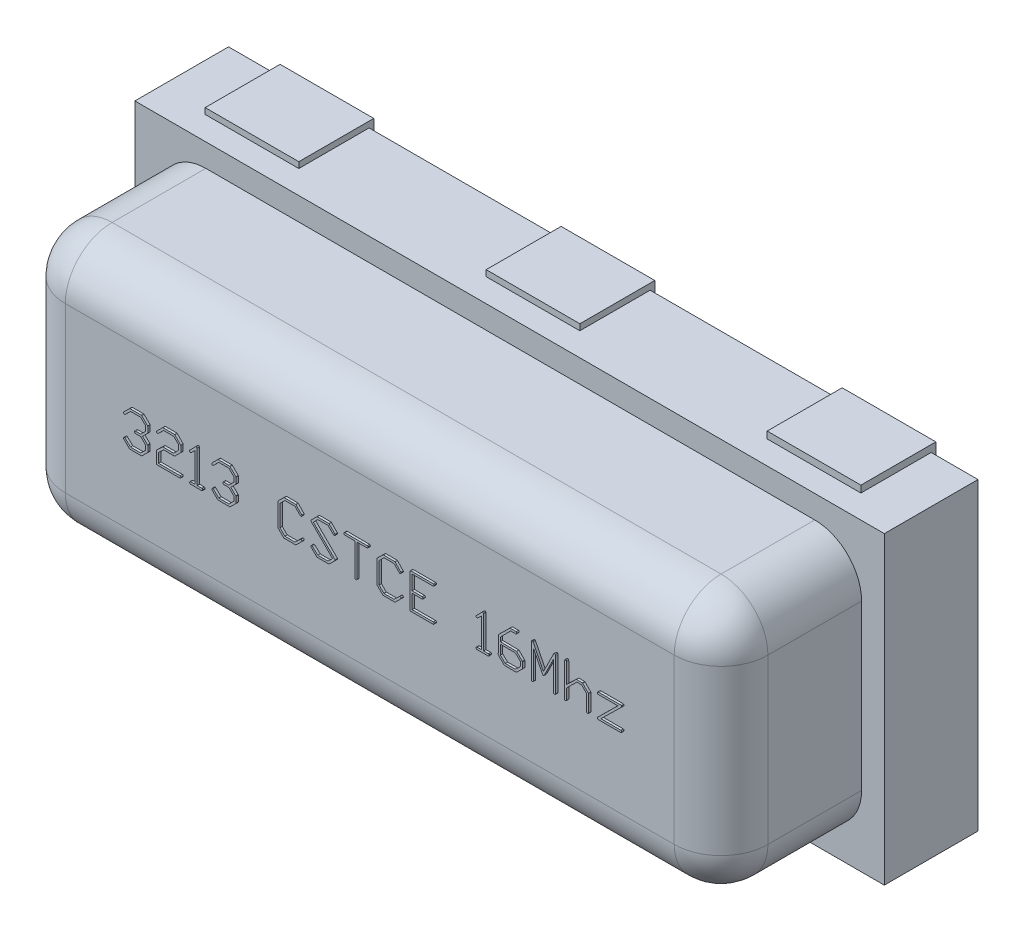
from build123d import *

# Parameters (mm, degrees)
SKETCH2_W                  = 3.2
SKETCH2_H                  = 1.3
BOSS_EXTRUDE1_DEPTH        = 0.4
SKETCH3_W                  = 3
SKETCH3_H                  = 1.1
BOSS_EXTRUDE2_DEPTH        = 0.6
FILLET1_R                  = 0.2
FILLET2_R                  = 0.2
BOSS_EXTRUDE4_DEPTH        = 0.3
BOSS_EXTRUDE4_DEPTH_BACK   = 0.02
SKETCH5_W                  = 0.4
SKETCH5_H                  = 1.35
BOSS_EXTRUDE4_2_DEPTH      = 0.3
BOSS_EXTRUDE4_2_DEPTH_BACK = 0.02
BOSS_EXTRUDE4_3_DEPTH      = 0.3
BOSS_EXTRUDE4_3_DEPTH_BACK = 0.02
BOSS_EXTRUDE5_DEPTH        = 0.01


# Read off the part's stored shape, not the designer's step: Boss-Extrude5
with BuildPart() as part:
    # Sketch2 → Boss-Extrude1 (new body)
    with BuildSketch(Plane.XY):
        with Locations((1.6, 0.65)):
            Rectangle(SKETCH2_W, SKETCH2_H)
    extrude(amount=BOSS_EXTRUDE1_DEPTH)


with BuildPart() as body_2:
    # Sketch3 → Boss-Extrude2 (new body)
    with BuildSketch(Plane.XY.offset(0.4)):
        with Locations((1.602928939, 0.652066437)):
            Rectangle(SKETCH3_W, SKETCH3_H)
    extrude(amount=BOSS_EXTRUDE2_DEPTH)

    # Fillet1
    fillet1_edges = [body_2.edges().sort_by_distance(p)[0] for p in [
        (3.102928939, 0.652066437, 1),
        (1.602928939, 1.202066437, 1),
        (0.102928939, 0.652066437, 1),
        (1.602928939, 0.102066437, 1),
    ]]
    fillet(fillet1_edges, radius=FILLET1_R)

    # Fillet2
    # the kernel refuses this fillet: 0.2 mm, written as the material it takes off along each edge
    with BuildSketch(Plane(origin=(2.902928939, 0.302066437, 0.8), x_dir=(0, -1, 0), z_dir=(1, 0, 0))) as fillet2_piece_1_section:
        Polygon((0, 0), (FILLET2_R, 0), (FILLET2_R, -FILLET2_R), (0, -FILLET2_R), align=None)
    fillet2_piece_1 = extrude(amount=FILLET2_R, mode=Mode.PRIVATE)
    fillet2_piece_1 = fillet2_piece_1 - Plane(origin=(2.902928939, 0.302066437, 0.8), x_dir=(0, 0.7071067811865475, -0.7071067811865475), z_dir=(1, 0, 0)) * Sphere(FILLET2_R, mode=Mode.PRIVATE)
    add(fillet2_piece_1, mode=Mode.SUBTRACT)
    with BuildSketch(Plane(origin=(0.302928939, 0.302066437, 0.8), x_dir=(0, -1, 0), z_dir=(-1, 0, 0))) as fillet2_piece_2_section:
        Polygon((0, 0), (FILLET2_R, 0), (FILLET2_R, FILLET2_R), (0, FILLET2_R), align=None)
    fillet2_piece_2 = extrude(amount=FILLET2_R, mode=Mode.PRIVATE)
    fillet2_piece_2 = fillet2_piece_2 - Plane(origin=(0.302928939, 0.302066437, 0.8), x_dir=(0, 0.7071067811865475, -0.7071067811865475), z_dir=(-1, 0, 0)) * Sphere(FILLET2_R, mode=Mode.PRIVATE)
    add(fillet2_piece_2, mode=Mode.SUBTRACT)
    with BuildSketch(Plane(origin=(2.902928939, 1.002066437, 0.8), x_dir=(1, 0, 0), z_dir=(0, 1, 0))) as fillet2_piece_3_section:
        Polygon((0, 0), (FILLET2_R, 0), (FILLET2_R, -FILLET2_R), (0, -FILLET2_R), align=None)
    fillet2_piece_3 = extrude(amount=FILLET2_R, mode=Mode.PRIVATE)
    fillet2_piece_3 = fillet2_piece_3 - Plane(origin=(2.902928939, 1.002066437, 0.8), x_dir=(-0.7071067811865475, 0, -0.7071067811865475), z_dir=(0, 1, 0)) * Sphere(FILLET2_R, mode=Mode.PRIVATE)
    add(fillet2_piece_3, mode=Mode.SUBTRACT)
    with BuildSketch(Plane(origin=(0.302928939, 1.002066437, 0.8), x_dir=(-1, 0, 0), z_dir=(0, 1, 0))) as fillet2_piece_4_section:
        Polygon((0, 0), (FILLET2_R, 0), (FILLET2_R, FILLET2_R), (0, FILLET2_R), align=None)
    fillet2_piece_4 = extrude(amount=FILLET2_R, mode=Mode.PRIVATE)
    fillet2_piece_4 = fillet2_piece_4 - Plane(origin=(0.302928939, 1.002066437, 0.8), x_dir=(0.7071067811865475, 0, -0.7071067811865475), z_dir=(0, 1, 0)) * Sphere(FILLET2_R, mode=Mode.PRIVATE)
    add(fillet2_piece_4, mode=Mode.SUBTRACT)
    with BuildSketch(Plane(origin=(0.102928939, 1.202066437, -0.1), x_dir=(1, 0, 0), z_dir=(0, 0, 1)), Plane(origin=(0.102928939, 0.102066437, -0.1), x_dir=(0, 1, 0), z_dir=(0, 0, 1))) as fillet2_piece_5:
        with BuildLine():
            CenterArc((FILLET2_R, -FILLET2_R), FILLET2_R, 90, 90)
            Line((0, -FILLET2_R), (0, 0))
            Line((0, 0), (FILLET2_R, 0))
        make_face()
    extrude(amount=0.9, mode=Mode.SUBTRACT)
    with BuildSketch(Plane(origin=(3.102928939, 1.202066437, -0.1), x_dir=(-1, 0, 0), z_dir=(0, 0, 1)), Plane(origin=(3.102928939, 0.102066437, -0.1), x_dir=(0, 1, 0), z_dir=(0, 0, 1))) as fillet2_piece_6:
        with BuildLine():
            CenterArc((FILLET2_R, FILLET2_R), FILLET2_R, 180, 90)
            Line((0, FILLET2_R), (0, 0))
            Line((0, 0), (FILLET2_R, 0))
        make_face()
    extrude(amount=0.9, mode=Mode.SUBTRACT)


with BuildPart() as body_3:
    # Sketch5 → Boss-Extrude4 (new, two sides: drawn at the far end of the back side and taken through both)
    with BuildSketch(Plane.XY.offset(-BOSS_EXTRUDE4_DEPTH_BACK)):
        with Locations((0.4, 0.650355211)):
            Rectangle(SKETCH5_W, SKETCH5_H)
    extrude(amount=BOSS_EXTRUDE4_DEPTH + BOSS_EXTRUDE4_DEPTH_BACK)


with BuildPart() as body_4:
    # Sketch5 → Boss-Extrude4 2 (new, two sides: drawn at the far end of the back side and taken through both)
    with BuildSketch(Plane.XY.offset(-BOSS_EXTRUDE4_2_DEPTH_BACK)):
        with Locations((1.6, 0.65103859)):
            Rectangle(SKETCH5_W, SKETCH5_H)
    extrude(amount=BOSS_EXTRUDE4_2_DEPTH + BOSS_EXTRUDE4_2_DEPTH_BACK)


with BuildPart() as body_5:
    # Sketch5 → Boss-Extrude4 3 (new, two sides: drawn at the far end of the back side and taken through both)
    with BuildSketch(Plane.XY.offset(-BOSS_EXTRUDE4_3_DEPTH_BACK)):
        with Locations((2.8, 0.654278449)):
            Rectangle(SKETCH5_W, SKETCH5_H)
    extrude(amount=BOSS_EXTRUDE4_3_DEPTH + BOSS_EXTRUDE4_3_DEPTH_BACK)


with BuildPart() as body_6:
    # Boss-Extrude5 outline → Boss-Extrude5 (new body)
    # profile 1 of 14: a face of its own
    with BuildSketch(Plane.XY.offset(1)):
        with BuildLine():
            add(Edge.make_bspline(
                [(2.683168451, 0.713430924), (2.683935612, 0.713401431), (2.685374021, 0.713346131), (2.686666749, 0.71271908), (2.687270013, 0.71242646)],
                knots=[0, 0, 0, 0, 0.533340216, 1, 1, 1, 1], degree=3))
            Line((2.683168451, 0.713430924), (2.591706397, 0.713430924))
            add(Edge.make_bspline(
                [(2.584730951, 0.708129585), (2.584772838, 0.708887929), (2.584848696, 0.710261285), (2.585570063, 0.711911603), (2.586716018, 0.712751094), (2.588009807, 0.713174934), (2.589717866, 0.713391381), (2.590998908, 0.713416855), (2.591706397, 0.713430924)],
                knots=[0, 0, 0, 0, 0.221332897, 0.400832246, 0.499547483, 0.62651614, 0.793733864, 1, 1, 1, 1], degree=3))
            add(Edge.make_bspline(
                [(2.587576933, 0.704502353), (2.587199603, 0.704686145), (2.586464753, 0.70504408), (2.585629939, 0.705917345), (2.584986842, 0.706937079), (2.584818756, 0.707720392), (2.584730951, 0.708129585)],
                knots=[0, 0, 0, 0, 0.259332585, 0.505050121, 0.741444638, 1, 1, 1, 1], degree=3))
            Line((2.587576933, 0.704502353), (2.672621576, 0.704502353))
            Line((2.672621576, 0.704502353), (2.585735415, 0.61867646))
            add(Edge.make_bspline(
                [(2.584730951, 0.615663067), (2.584784937, 0.616156228), (2.584902523, 0.617230356), (2.585443056, 0.618168852), (2.585735415, 0.61867646)],
                knots=[0, 0, 0, 0, 0.459127183, 1, 1, 1, 1], degree=3))
            add(Edge.make_bspline(
                [(2.587604835, 0.61164521), (2.587230396, 0.611841223), (2.586493395, 0.612227031), (2.58558199, 0.613127853), (2.58499499, 0.614318376), (2.584821589, 0.615201469), (2.584730951, 0.615663067)],
                knots=[0, 0, 0, 0, 0.243908595, 0.480079756, 0.728234661, 1, 1, 1, 1], degree=3))
            Line((2.587604835, 0.61164521), (2.68378229, 0.61164521))
            add(Edge.make_bspline(
                [(2.68830238, 0.616862844), (2.688280011, 0.616105081), (2.68824022, 0.614757112), (2.687707496, 0.613195303), (2.686951287, 0.6123025), (2.686091599, 0.611926922), (2.68502495, 0.611679088), (2.684221518, 0.611657184), (2.68378229, 0.61164521)],
                knots=[0, 0, 0, 0, 0.279967249, 0.498028594, 0.595548592, 0.703348784, 0.837823744, 1, 1, 1, 1], degree=3))
            add(Edge.make_bspline(
                [(2.685623808, 0.620573781), (2.686030341, 0.620445669), (2.686805065, 0.620201528), (2.687699333, 0.619352521), (2.688236673, 0.61820016), (2.688279202, 0.617334567), (2.68830238, 0.616862844)],
                knots=[0, 0, 0, 0, 0.253478621, 0.483050086, 0.718277531, 1, 1, 1, 1], degree=3))
            Line((2.685623808, 0.620573781), (2.599574701, 0.620573781))
            Line((2.599574701, 0.620573781), (2.687270013, 0.706399674))
            Line((2.687270013, 0.706399674), (2.68830238, 0.708408603))
            add(Edge.make_bspline(
                [(2.687270013, 0.71242646), (2.687574051, 0.71184293), (2.688228469, 0.710586927), (2.688276606, 0.709168199), (2.68830238, 0.708408603)],
                knots=[0, 0, 0, 0, 0.464593162, 1, 1, 1, 1], degree=3))
        make_face()
    # profile 2 of 14: a face of its own
    with BuildSketch(Plane.XY.offset(1)):
        with BuildLine():
            add(Edge.make_bspline(
                [(2.447286755, 0.76164521), (2.447715051, 0.761625023), (2.448520638, 0.761587053), (2.449640172, 0.76141946), (2.450577908, 0.761053499), (2.451069603, 0.760679833), (2.451304612, 0.760501237)],
                knots=[0, 0, 0, 0, 0.301552047, 0.567191846, 0.793137002, 1, 1, 1, 1], degree=3))
            add(Edge.make_bspline(
                [(2.443659522, 0.758799228), (2.443812181, 0.759177181), (2.444111669, 0.759918653), (2.444971525, 0.760761269), (2.446028678, 0.761398563), (2.44684942, 0.76155947), (2.447286755, 0.76164521)],
                knots=[0, 0, 0, 0, 0.248858434, 0.488213124, 0.727292693, 1, 1, 1, 1], degree=3))
            Line((2.443659522, 0.758799228), (2.443659522, 0.616137397))
            add(Edge.make_bspline(
                [(2.448123808, 0.61164521), (2.447494471, 0.611677364), (2.446335389, 0.611736583), (2.445002066, 0.612331666), (2.444262074, 0.613135775), (2.443930968, 0.613964313), (2.443697321, 0.614980547), (2.443672954, 0.615726304), (2.443659522, 0.616137397)],
                knots=[0, 0, 0, 0, 0.256595266, 0.472584446, 0.574906464, 0.695760317, 0.832289746, 1, 1, 1, 1], degree=3))
            add(Edge.make_bspline(
                [(2.450244344, 0.612035835), (2.449968169, 0.611929105), (2.44928874, 0.611666534), (2.448557696, 0.611653152), (2.448123808, 0.61164521)],
                knots=[0, 0, 0, 0, 0.406481431, 1, 1, 1, 1], degree=3))
            add(Edge.make_bspline(
                [(2.452588094, 0.614853915), (2.452530147, 0.614586783), (2.452410386, 0.614034686), (2.451889316, 0.613300288), (2.451168214, 0.61261258), (2.450569164, 0.612238611), (2.450244344, 0.612035835)],
                knots=[0, 0, 0, 0, 0.214295645, 0.442897145, 0.697924591, 1, 1, 1, 1], degree=3))
            Line((2.452588094, 0.614853915), (2.452588094, 0.660584942))
            Line((2.452588094, 0.660584942), (2.497175147, 0.704502353))
            Line((2.497175147, 0.704502353), (2.517320237, 0.704502353))
            Line((2.517320237, 0.704502353), (2.53830238, 0.683631817))
            Line((2.53830238, 0.683631817), (2.53830238, 0.616053692))
            add(Edge.make_bspline(
                [(2.542766665, 0.61164521), (2.542172128, 0.611688375), (2.541030213, 0.611771281), (2.53973512, 0.612428966), (2.538948254, 0.613225177), (2.538570569, 0.614031266), (2.538345598, 0.614990381), (2.538317562, 0.615680144), (2.53830238, 0.616053692)],
                knots=[0, 0, 0, 0, 0.248006539, 0.476341557, 0.589355914, 0.711352775, 0.843680326, 1, 1, 1, 1], degree=3))
            add(Edge.make_bspline(
                [(2.547230951, 0.614881817), (2.547091087, 0.614389859), (2.546827442, 0.61346251), (2.54583315, 0.612342492), (2.544406641, 0.611726627), (2.543340092, 0.611673678), (2.542766665, 0.61164521)],
                knots=[0, 0, 0, 0, 0.251043116, 0.473220466, 0.71677834, 1, 1, 1, 1], degree=3))
            Line((2.547230951, 0.614881817), (2.547230951, 0.685808156))
            Line((2.547230951, 0.685808156), (2.546812424, 0.687621772))
            Line((2.546812424, 0.687621772), (2.522091442, 0.71242646))
            Line((2.522091442, 0.71242646), (2.520668451, 0.713235612))
            Line((2.520668451, 0.713235612), (2.495110415, 0.713430924))
            Line((2.495110415, 0.713430924), (2.452588094, 0.673001237))
            Line((2.452588094, 0.673001237), (2.452588094, 0.755478915))
            add(Edge.make_bspline(
                [(2.451304612, 0.760501237), (2.451505565, 0.760268644), (2.451962502, 0.759739764), (2.452343529, 0.758602773), (2.452543855, 0.757152224), (2.452572327, 0.756075304), (2.452588094, 0.755478915)],
                knots=[0, 0, 0, 0, 0.172388993, 0.391985546, 0.663286927, 1, 1, 1, 1], degree=3))
        make_face()
    # profile 3 of 14: a face of its own
    with BuildSketch(Plane.XY.offset(1)):
        with BuildLine():
            add(Edge.make_bspline(
                [(2.306689656, 0.76164521), (2.307279822, 0.761599152), (2.30843247, 0.761509198), (2.309323862, 0.760775547), (2.309758853, 0.760417531)],
                knots=[0, 0, 0, 0, 0.512009106, 1, 1, 1, 1], degree=3))
            add(Edge.make_bspline(
                [(2.302588094, 0.758603915), (2.302747692, 0.75901068), (2.303060145, 0.759807022), (2.30400624, 0.760744824), (2.305236684, 0.761402348), (2.306188177, 0.761561388), (2.306689656, 0.76164521)],
                knots=[0, 0, 0, 0, 0.239567387, 0.46901277, 0.720146469, 1, 1, 1, 1], degree=3))
            Line((2.302588094, 0.758603915), (2.302588094, 0.616109496))
            add(Edge.make_bspline(
                [(2.30705238, 0.61164521), (2.306423257, 0.61167745), (2.30526457, 0.611736829), (2.303929073, 0.612331035), (2.303199192, 0.613130538), (2.302847721, 0.613950608), (2.30263301, 0.614963753), (2.302603823, 0.615708262), (2.302588094, 0.616109496)],
                knots=[0, 0, 0, 0, 0.257507819, 0.474265142, 0.576951057, 0.694762655, 0.83550055, 1, 1, 1, 1], degree=3))
            add(Edge.make_bspline(
                [(2.309172915, 0.612063737), (2.308897384, 0.611945774), (2.308223697, 0.611657349), (2.307487487, 0.611649719), (2.30705238, 0.61164521)],
                knots=[0, 0, 0, 0, 0.408990785, 1, 1, 1, 1], degree=3))
            add(Edge.make_bspline(
                [(2.311516665, 0.614881817), (2.311459093, 0.614614279), (2.311340106, 0.614061342), (2.310808805, 0.613328456), (2.310114554, 0.61260948), (2.309500665, 0.61225369), (2.309172915, 0.612063737)],
                knots=[0, 0, 0, 0, 0.214062419, 0.442415124, 0.702309876, 1, 1, 1, 1], degree=3))
            Line((2.311516665, 0.614881817), (2.311516665, 0.738096103))
            Line((2.311516665, 0.738096103), (2.350411755, 0.660584942))
            add(Edge.make_bspline(
                [(2.354680728, 0.657934272), (2.354227968, 0.65796174), (2.353356109, 0.658014634), (2.352163621, 0.658562366), (2.35112641, 0.659401766), (2.350658992, 0.660175617), (2.350411755, 0.660584942)],
                knots=[0, 0, 0, 0, 0.255076558, 0.491189508, 0.730867291, 1, 1, 1, 1], degree=3))
            add(Edge.make_bspline(
                [(2.357945237, 0.65977579), (2.357735744, 0.659492511), (2.357339257, 0.658956375), (2.356538662, 0.658381761), (2.35565569, 0.657983596), (2.35501075, 0.657950968), (2.354680728, 0.657934272)],
                knots=[0, 0, 0, 0, 0.268712098, 0.508567368, 0.74852884, 1, 1, 1, 1], degree=3))
            Line((2.357945237, 0.65977579), (2.396617112, 0.737677576))
            Line((2.396617112, 0.737677576), (2.397230951, 0.738096103))
            Line((2.397230951, 0.738096103), (2.397230951, 0.616109496))
            add(Edge.make_bspline(
                [(2.401695237, 0.61164521), (2.401101879, 0.611689447), (2.399962229, 0.611774413), (2.398647455, 0.612423087), (2.397885645, 0.613251969), (2.39749209, 0.614065595), (2.397278203, 0.615038311), (2.397247411, 0.61573636), (2.397230951, 0.616109496)],
                knots=[0, 0, 0, 0, 0.246369753, 0.473197812, 0.588300644, 0.709492354, 0.844711999, 1, 1, 1, 1], degree=3))
            add(Edge.make_bspline(
                [(2.406159522, 0.614909719), (2.406017546, 0.614419538), (2.405747957, 0.613488768), (2.404772937, 0.612341475), (2.403333796, 0.611727816), (2.402268169, 0.611674094), (2.401695237, 0.61164521)],
                knots=[0, 0, 0, 0, 0.25017541, 0.475041228, 0.717757267, 1, 1, 1, 1], degree=3))
            Line((2.406159522, 0.614909719), (2.406159522, 0.753721103))
            add(Edge.make_bspline(
                [(2.405127156, 0.760417531), (2.405289365, 0.76010631), (2.405677739, 0.759361155), (2.405957435, 0.757889344), (2.406144768, 0.755968586), (2.406154265, 0.754521994), (2.406159522, 0.753721103)],
                knots=[0, 0, 0, 0, 0.153157065, 0.36670278, 0.64938092, 1, 1, 1, 1], degree=3))
            add(Edge.make_bspline(
                [(2.401444121, 0.76164521), (2.402041294, 0.761578041), (2.403352662, 0.761430542), (2.404501486, 0.76077471), (2.405127156, 0.760417531)],
                knots=[0, 0, 0, 0, 0.455381915, 1, 1, 1, 1], degree=3))
            add(Edge.make_bspline(
                [(2.398374924, 0.759999004), (2.398820688, 0.760378878), (2.399724435, 0.761149038), (2.400865749, 0.761478335), (2.401444121, 0.76164521)],
                knots=[0, 0, 0, 0, 0.493240309, 1, 1, 1, 1], degree=3))
            Line((2.398374924, 0.759999004), (2.354262201, 0.671968871))
            Line((2.354262201, 0.671968871), (2.310986531, 0.758771326))
            Line((2.310986531, 0.758771326), (2.309758853, 0.760417531))
        make_face()
    # profile 4 of 14: a face of its own
    with BuildSketch(Plane.XY.offset(1)):
        with BuildLine():
            add(Edge.make_bspline(
                [(2.24064613, 0.75695771), (2.240621753, 0.756409225), (2.240576851, 0.755398888), (2.239911698, 0.754069696), (2.238836534, 0.753086999), (2.237903196, 0.752844765), (2.237409522, 0.752716638)],
                knots=[0, 0, 0, 0, 0.27837494, 0.512781454, 0.742293764, 1, 1, 1, 1], degree=3))
            add(Edge.make_bspline(
                [(2.237800147, 0.761421996), (2.238332368, 0.76109397), (2.23927051, 0.760515761), (2.240172137, 0.75928144), (2.240578719, 0.758091494), (2.24062442, 0.757322848), (2.24064613, 0.75695771)],
                knots=[0, 0, 0, 0, 0.333148493, 0.58723824, 0.803921457, 1, 1, 1, 1], degree=3))
            Line((2.237800147, 0.761421996), (2.212158406, 0.76164521))
            Line((2.212158406, 0.76164521), (2.162130505, 0.712593871))
            Line((2.162130505, 0.712593871), (2.161516665, 0.639519094))
            Line((2.161516665, 0.639519094), (2.161711978, 0.637482263))
            Line((2.161711978, 0.637482263), (2.186795683, 0.612454362))
            Line((2.186795683, 0.612454362), (2.188023362, 0.61164521))
            Line((2.188023362, 0.61164521), (2.237130505, 0.61164521))
            Line((2.237130505, 0.61164521), (2.239195237, 0.611840522))
            Line((2.239195237, 0.611840522), (2.264474255, 0.636421996))
            Line((2.264474255, 0.636421996), (2.265088094, 0.638040299))
            Line((2.265088094, 0.638040299), (2.265088094, 0.663012397))
            Line((2.265088094, 0.663012397), (2.264474255, 0.664435388))
            Line((2.264474255, 0.664435388), (2.239753272, 0.689407487))
            Line((2.239753272, 0.689407487), (2.170445237, 0.690216638))
            Line((2.170445237, 0.690216638), (2.170445237, 0.707906371))
            Line((2.170445237, 0.707906371), (2.214753272, 0.752716638))
            Line((2.214753272, 0.752716638), (2.237409522, 0.752716638))
        make_face()
        Polygon((2.256159522, 0.641276906), (2.23517738, 0.620573781), (2.19142738, 0.620573781), (2.170445237, 0.641081594), (2.170445237, 0.681288067), (2.234982067, 0.681288067), (2.256159522, 0.660584942), align=None, mode=Mode.SUBTRACT)
    # profile 5 of 14: a face of its own
    with BuildSketch(Plane.XY.offset(1)):
        with BuildLine():
            add(Edge.make_bspline(
                [(2.094747692, 0.76164521), (2.094963543, 0.761604555), (2.095594917, 0.761485638), (2.096612682, 0.761014889), (2.097848864, 0.760393362), (2.098354864, 0.759599451), (2.098598138, 0.759217754)],
                knots=[0, 0, 0, 0, 0.139875478, 0.409141264, 0.715927102, 1, 1, 1, 1], degree=3))
            add(Edge.make_bspline(
                [(2.092515549, 0.761031371), (2.092833177, 0.761216783), (2.093520407, 0.761617948), (2.094318478, 0.761635676), (2.094747692, 0.76164521)],
                knots=[0, 0, 0, 0, 0.462186758, 1, 1, 1, 1], degree=3))
            Line((2.092515549, 0.761031371), (2.067292335, 0.735194317))
            Line((2.067292335, 0.735194317), (2.066873808, 0.733296996))
            add(Edge.make_bspline(
                [(2.071086978, 0.728721103), (2.070525914, 0.728769631), (2.069421213, 0.728865179), (2.067968666, 0.729791173), (2.066992764, 0.731358771), (2.066915892, 0.732611294), (2.066873808, 0.733296996)],
                knots=[0, 0, 0, 0, 0.23853799, 0.469666889, 0.709665872, 1, 1, 1, 1], degree=3))
            add(Edge.make_bspline(
                [(2.073068005, 0.729139629), (2.072708411, 0.729021854), (2.072062636, 0.728810346), (2.071386579, 0.728748507), (2.071086978, 0.728721103)],
                knots=[0, 0, 0, 0, 0.55684002, 1, 1, 1, 1], degree=3))
            Line((2.073068005, 0.729139629), (2.090088094, 0.74602021))
            Line((2.090088094, 0.74602021), (2.090088094, 0.620573781))
            Line((2.090088094, 0.620573781), (2.072928496, 0.620573781))
            add(Edge.make_bspline(
                [(2.066873808, 0.615272442), (2.066913237, 0.6160336), (2.066984642, 0.617412052), (2.067721124, 0.619013592), (2.068742892, 0.619877974), (2.069860524, 0.620311064), (2.071291715, 0.620533062), (2.072351008, 0.620559415), (2.072928496, 0.620573781)],
                knots=[0, 0, 0, 0, 0.242213584, 0.438647016, 0.53972528, 0.66208916, 0.815783603, 1, 1, 1, 1], degree=3))
            add(Edge.make_bspline(
                [(2.06971979, 0.61164521), (2.069341837, 0.611797869), (2.068600365, 0.612097357), (2.067757749, 0.612957212), (2.067120455, 0.614014365), (2.066959548, 0.614835107), (2.066873808, 0.615272442)],
                knots=[0, 0, 0, 0, 0.248858434, 0.488213124, 0.727292693, 1, 1, 1, 1], degree=3))
            Line((2.06971979, 0.61164521), (2.117710862, 0.61164521))
            add(Edge.make_bspline(
                [(2.122398362, 0.616862844), (2.12236423, 0.616142188), (2.12230144, 0.614816445), (2.121729036, 0.613263138), (2.120909013, 0.61236668), (2.12003263, 0.611958113), (2.118957155, 0.611670144), (2.118150574, 0.611654007), (2.117710862, 0.61164521)],
                knots=[0, 0, 0, 0, 0.265238537, 0.487942447, 0.592146678, 0.704011385, 0.838640234, 1, 1, 1, 1], degree=3))
            add(Edge.make_bspline(
                [(2.11955238, 0.620573781), (2.119929235, 0.620409956), (2.120664857, 0.62009017), (2.121524401, 0.619231632), (2.122149886, 0.618145552), (2.122311997, 0.617308684), (2.122398362, 0.616862844)],
                knots=[0, 0, 0, 0, 0.248174646, 0.484436232, 0.725334133, 1, 1, 1, 1], degree=3))
            Line((2.11955238, 0.620573781), (2.099016665, 0.620573781))
            Line((2.099016665, 0.620573781), (2.099016665, 0.756985612))
            Line((2.099016665, 0.756985612), (2.098598138, 0.759217754))
        make_face()
    # profile 6 of 14: a face of its own
    with BuildSketch(Plane.XY.offset(1)):
        with BuildLine():
            add(Edge.make_bspline(
                [(1.784730951, 0.758799228), (1.784859462, 0.759127877), (1.785118651, 0.759790714), (1.78591127, 0.760590023), (1.786937055, 0.761247175), (1.787754106, 0.761506575), (1.788190772, 0.76164521)],
                knots=[0, 0, 0, 0, 0.224274438, 0.452329049, 0.707301855, 1, 1, 1, 1], degree=3))
            Line((1.784730951, 0.758799228), (1.784730951, 0.614295879))
            add(Edge.make_bspline(
                [(1.787381621, 0.61164521), (1.787067909, 0.611791726), (1.78646513, 0.612073249), (1.785690382, 0.612675264), (1.785073312, 0.613410464), (1.784845739, 0.613999015), (1.784730951, 0.614295879)],
                knots=[0, 0, 0, 0, 0.267516838, 0.514018269, 0.754871847, 1, 1, 1, 1], degree=3))
            Line((1.787381621, 0.61164521), (1.882777826, 0.61164521))
            add(Edge.make_bspline(
                [(1.887465326, 0.616109496), (1.887416646, 0.615611456), (1.887313923, 0.614560501), (1.886744634, 0.613307179), (1.885973822, 0.612428688), (1.885116379, 0.611943938), (1.884021475, 0.611675561), (1.883216605, 0.611655918), (1.882777826, 0.61164521)],
                knots=[0, 0, 0, 0, 0.202834733, 0.428018706, 0.545877062, 0.67308486, 0.821780474, 1, 1, 1, 1], degree=3))
            add(Edge.make_bspline(
                [(1.884033406, 0.620573781), (1.884552452, 0.620435173), (1.885521942, 0.620176277), (1.886710454, 0.61919118), (1.887356455, 0.617753286), (1.887427328, 0.616683215), (1.887465326, 0.616109496)],
                knots=[0, 0, 0, 0, 0.2582419, 0.482351811, 0.722462655, 1, 1, 1, 1], degree=3))
            Line((1.884033406, 0.620573781), (1.793659522, 0.620573781))
            Line((1.793659522, 0.620573781), (1.793659522, 0.681288067))
            Line((1.793659522, 0.681288067), (1.835819121, 0.681288067))
            add(Edge.make_bspline(
                [(1.840255505, 0.685975567), (1.84022761, 0.68544165), (1.840173506, 0.684406077), (1.8397126, 0.683166173), (1.839026255, 0.682331385), (1.838188609, 0.681877153), (1.837114222, 0.681472849), (1.836279541, 0.681353759), (1.835819121, 0.681288067)],
                knots=[0, 0, 0, 0, 0.218844043, 0.424464368, 0.530072597, 0.655146557, 0.809774852, 1, 1, 1, 1], degree=3))
            add(Edge.make_bspline(
                [(1.837018897, 0.690216638), (1.837510147, 0.690023226), (1.838427032, 0.689662234), (1.839506885, 0.688681055), (1.840167546, 0.687411606), (1.840225388, 0.686467266), (1.840255505, 0.685975567)],
                knots=[0, 0, 0, 0, 0.273653766, 0.510756747, 0.745260713, 1, 1, 1, 1], degree=3))
            Line((1.837018897, 0.690216638), (1.793659522, 0.690216638))
            Line((1.793659522, 0.690216638), (1.793659522, 0.752716638))
            Line((1.793659522, 0.752716638), (1.881382737, 0.752716638))
            add(Edge.make_bspline(
                [(1.887465326, 0.758017978), (1.887422164, 0.75725968), (1.887343527, 0.755878113), (1.886639283, 0.754246385), (1.885585146, 0.753416584), (1.884480648, 0.752977016), (1.883037499, 0.752756726), (1.881969303, 0.752730848), (1.881382737, 0.752716638)],
                knots=[0, 0, 0, 0, 0.241315123, 0.439660043, 0.53847926, 0.660389247, 0.81351358, 1, 1, 1, 1], degree=3))
            add(Edge.make_bspline(
                [(1.884619344, 0.761421996), (1.884995441, 0.761329613), (1.885728804, 0.761149473), (1.886611592, 0.76038113), (1.887224177, 0.759312137), (1.887380485, 0.75847329), (1.887465326, 0.758017978)],
                knots=[0, 0, 0, 0, 0.239964392, 0.467913749, 0.711192042, 1, 1, 1, 1], degree=3))
            Line((1.884619344, 0.761421996), (1.788190772, 0.76164521))
        make_face()
    # profile 7 of 14: a face of its own
    with BuildSketch(Plane.XY.offset(1)):
        with BuildLine():
            add(Edge.make_bspline(
                [(1.742152826, 0.643090522), (1.742628647, 0.643019796), (1.743664051, 0.642865894), (1.744798175, 0.642091241), (1.745612529, 0.641276448), (1.746056561, 0.640505269), (1.746360564, 0.639643591), (1.746382507, 0.639028977), (1.746393897, 0.638709942)],
                knots=[0, 0, 0, 0, 0.212986259, 0.463465698, 0.595876311, 0.726444143, 0.858002389, 1, 1, 1, 1], degree=3))
            add(Edge.make_bspline(
                [(1.740115996, 0.642504585), (1.740415403, 0.642678762), (1.741043911, 0.64304439), (1.741771726, 0.643074668), (1.742152826, 0.643090522)],
                knots=[0, 0, 0, 0, 0.476378372, 1, 1, 1, 1], degree=3))
            Line((1.740115996, 0.642504585), (1.717013317, 0.620573781))
            Line((1.717013317, 0.620573781), (1.67345863, 0.620573781))
            Line((1.67345863, 0.620573781), (1.652588094, 0.641416415))
            Line((1.652588094, 0.641416415), (1.652588094, 0.731678692))
            Line((1.652588094, 0.731678692), (1.67345863, 0.752716638))
            Line((1.67345863, 0.752716638), (1.717013317, 0.752716638))
            Line((1.717013317, 0.752716638), (1.738888317, 0.730171996))
            add(Edge.make_bspline(
                [(1.742348138, 0.72852579), (1.741662793, 0.728679293), (1.740381473, 0.72896628), (1.739362341, 0.729789224), (1.738888317, 0.730171996)],
                knots=[0, 0, 0, 0, 0.534874603, 1, 1, 1, 1], degree=3))
            add(Edge.make_bspline(
                [(1.746198585, 0.731455478), (1.746015941, 0.731068352), (1.745657895, 0.730309452), (1.744746627, 0.72943773), (1.743645989, 0.728772997), (1.742794873, 0.728610881), (1.742348138, 0.72852579)],
                knots=[0, 0, 0, 0, 0.250955424, 0.491959519, 0.733339497, 1, 1, 1, 1], degree=3))
            add(Edge.make_bspline(
                [(1.746393897, 0.732906371), (1.746391645, 0.732606219), (1.746387945, 0.732113075), (1.746251847, 0.731640442), (1.746198585, 0.731455478)],
                knots=[0, 0, 0, 0, 0.608649893, 1, 1, 1, 1], degree=3))
            add(Edge.make_bspline(
                [(1.745975371, 0.73477579), (1.746093985, 0.73448186), (1.746336087, 0.733881925), (1.74637437, 0.733235889), (1.746393897, 0.732906371)],
                knots=[0, 0, 0, 0, 0.48993725, 1, 1, 1, 1], degree=3))
            Line((1.745975371, 0.73477579), (1.721365996, 0.760389629))
            Line((1.721365996, 0.760389629), (1.719943005, 0.761449897))
            Line((1.719943005, 0.761449897), (1.670724255, 0.76164521))
            Line((1.670724255, 0.76164521), (1.669496576, 0.761226683))
            Line((1.669496576, 0.761226683), (1.644663987, 0.736617308))
            Line((1.644663987, 0.736617308), (1.643659522, 0.639519094))
            Line((1.643659522, 0.639519094), (1.643659522, 0.637482263))
            Line((1.643659522, 0.637482263), (1.668520013, 0.612454362))
            Line((1.668520013, 0.612454362), (1.669747692, 0.61164521))
            Line((1.669747692, 0.61164521), (1.719273362, 0.61164521))
            Line((1.719273362, 0.61164521), (1.720919567, 0.612035835))
            Line((1.720919567, 0.612035835), (1.745975371, 0.636728915))
            Line((1.745975371, 0.636728915), (1.746393897, 0.638709942))
        make_face()
    # profile 8 of 14: a face of its own
    with BuildSketch(Plane.XY.offset(1)):
        with BuildLine():
            add(Edge.make_bspline(
                [(1.502588094, 0.757069317), (1.502625388, 0.757661421), (1.50269447, 0.758758208), (1.503341457, 0.760240272), (1.504547437, 0.761243378), (1.505529158, 0.761506285), (1.506047915, 0.76164521)],
                knots=[0, 0, 0, 0, 0.281038595, 0.520582799, 0.746667986, 1, 1, 1, 1], degree=3))
            add(Edge.make_bspline(
                [(1.502978719, 0.754892978), (1.502872814, 0.755290674), (1.502682401, 0.756005715), (1.502617083, 0.756742377), (1.502588094, 0.757069317)],
                knots=[0, 0, 0, 0, 0.556186553, 1, 1, 1, 1], degree=3))
            add(Edge.make_bspline(
                [(1.505992112, 0.752716638), (1.505697672, 0.75274223), (1.505105377, 0.752793709), (1.504297236, 0.753270088), (1.503546744, 0.753952089), (1.503177191, 0.754564224), (1.502978719, 0.754892978)],
                knots=[0, 0, 0, 0, 0.224936537, 0.45248145, 0.705949786, 1, 1, 1, 1], degree=3))
            Line((1.505992112, 0.752716638), (1.549016665, 0.752716638))
            Line((1.549016665, 0.752716638), (1.549016665, 0.61633271))
            add(Edge.make_bspline(
                [(1.554234299, 0.61164521), (1.553513644, 0.611679341), (1.5521879, 0.611742131), (1.550634594, 0.612314536), (1.549738136, 0.613134559), (1.549329568, 0.614010942), (1.5490416, 0.615086417), (1.549025463, 0.615892998), (1.549016665, 0.61633271)],
                knots=[0, 0, 0, 0, 0.265238537, 0.487942447, 0.592146678, 0.704011385, 0.838640234, 1, 1, 1, 1], degree=3))
            add(Edge.make_bspline(
                [(1.557945237, 0.614491192), (1.557812788, 0.614113784), (1.557552585, 0.613372342), (1.556705746, 0.612504098), (1.555581942, 0.611885891), (1.554708095, 0.611729827), (1.554234299, 0.61164521)],
                knots=[0, 0, 0, 0, 0.238453023, 0.4684566, 0.711799804, 1, 1, 1, 1], degree=3))
            Line((1.557945237, 0.614491192), (1.557945237, 0.752716638))
            Line((1.557945237, 0.752716638), (1.599156174, 0.752716638))
            add(Edge.make_bspline(
                [(1.605322469, 0.758017978), (1.605282781, 0.75725775), (1.605210253, 0.755868444), (1.604467566, 0.754252197), (1.603409295, 0.75340857), (1.602288026, 0.75298384), (1.600830469, 0.752753403), (1.599752369, 0.75272973), (1.599156174, 0.752716638)],
                knots=[0, 0, 0, 0, 0.239632044, 0.437924053, 0.536054045, 0.659825042, 0.811881392, 1, 1, 1, 1], degree=3))
            add(Edge.make_bspline(
                [(1.602476487, 0.761421996), (1.602852584, 0.761329613), (1.603585947, 0.761149473), (1.604468735, 0.76038113), (1.60508132, 0.759312137), (1.605237628, 0.75847329), (1.605322469, 0.758017978)],
                knots=[0, 0, 0, 0, 0.239964392, 0.467913749, 0.711192042, 1, 1, 1, 1], degree=3))
            Line((1.602476487, 0.761421996), (1.506047915, 0.76164521))
        make_face()
    # profile 9 of 14: a face of its own
    with BuildSketch(Plane.XY.offset(1)):
        with BuildLine():
            add(Edge.make_bspline(
                [(1.361516665, 0.733827129), (1.361526671, 0.734079454), (1.361545738, 0.734560256), (1.361658428, 0.735027897), (1.361711978, 0.735250121)],
                knots=[0, 0, 0, 0, 0.524798482, 1, 1, 1, 1], degree=3))
            add(Edge.make_bspline(
                [(1.361935192, 0.731818201), (1.361817088, 0.732084258), (1.36153454, 0.732720764), (1.361523241, 0.733420109), (1.361516665, 0.733827129)],
                knots=[0, 0, 0, 0, 0.417997099, 1, 1, 1, 1], degree=3))
            Line((1.361935192, 0.731818201), (1.453871576, 0.639853915))
            Line((1.453871576, 0.639853915), (1.434758853, 0.620573781))
            Line((1.434758853, 0.620573781), (1.391008853, 0.620573781))
            Line((1.391008853, 0.620573781), (1.369050147, 0.641528022))
            add(Edge.make_bspline(
                [(1.365590326, 0.643090522), (1.365918729, 0.643079413), (1.366572325, 0.643057303), (1.36748947, 0.642729071), (1.368348942, 0.642244111), (1.368809477, 0.641773802), (1.369050147, 0.641528022)],
                knots=[0, 0, 0, 0, 0.250334477, 0.498222629, 0.737776012, 1, 1, 1, 1], degree=3))
            add(Edge.make_bspline(
                [(1.361711978, 0.640300344), (1.361905445, 0.640677607), (1.362277205, 0.641402539), (1.363180024, 0.642253491), (1.364291957, 0.642863918), (1.365145319, 0.643012855), (1.365590326, 0.643090522)],
                knots=[0, 0, 0, 0, 0.252145361, 0.484511819, 0.73118592, 1, 1, 1, 1], degree=3))
            add(Edge.make_bspline(
                [(1.361516665, 0.638905254), (1.361518443, 0.639196303), (1.361521346, 0.639671427), (1.361658745, 0.640124724), (1.361711978, 0.640300344)],
                knots=[0, 0, 0, 0, 0.612574113, 1, 1, 1, 1], degree=3))
            add(Edge.make_bspline(
                [(1.361935192, 0.636924228), (1.361817416, 0.637283821), (1.361605909, 0.637929596), (1.36154407, 0.638605653), (1.361516665, 0.638905254)],
                knots=[0, 0, 0, 0, 0.55684002, 1, 1, 1, 1], degree=3))
            Line((1.361935192, 0.636924228), (1.386795683, 0.612454362))
            Line((1.386795683, 0.612454362), (1.388023362, 0.61164521))
            Line((1.388023362, 0.61164521), (1.437130505, 0.61164521))
            Line((1.437130505, 0.61164521), (1.439195237, 0.611840522))
            Line((1.439195237, 0.611840522), (1.464055728, 0.636617308))
            Line((1.464055728, 0.636617308), (1.465088094, 0.637817085))
            add(Edge.make_bspline(
                [(1.465088094, 0.638654138), (1.465284872, 0.638479119), (1.465638444, 0.638164645), (1.465257171, 0.637923862), (1.465088094, 0.637817085)],
                knots=[0, 0, 0, 0, 0.556545319, 1, 1, 1, 1], degree=3))
            Line((1.465088094, 0.638654138), (1.465088094, 0.63946329))
            add(Edge.make_bspline(
                [(1.464474255, 0.641276906), (1.464659485, 0.641035579), (1.465067226, 0.640504354), (1.465080726, 0.639830838), (1.465088094, 0.63946329)],
                knots=[0, 0, 0, 0, 0.454285277, 1, 1, 1, 1], degree=3))
            Line((1.464474255, 0.641276906), (1.37189613, 0.733436504))
            Line((1.37189613, 0.733436504), (1.391204165, 0.752716638))
            Line((1.391204165, 0.752716638), (1.435316888, 0.752716638))
            Line((1.435316888, 0.752716638), (1.457498808, 0.730171996))
            add(Edge.make_bspline(
                [(1.460986531, 0.72852579), (1.460291196, 0.72867762), (1.458998874, 0.728959805), (1.457972801, 0.729788966), (1.457498808, 0.730171996)],
                knots=[0, 0, 0, 0, 0.538051739, 1, 1, 1, 1], degree=3))
            add(Edge.make_bspline(
                [(1.464669567, 0.731455478), (1.464548431, 0.731068255), (1.464309838, 0.730305569), (1.463459038, 0.729416636), (1.462342688, 0.728760081), (1.46146172, 0.728607884), (1.460986531, 0.72852579)],
                knots=[0, 0, 0, 0, 0.239097107, 0.470934269, 0.71462491, 1, 1, 1, 1], degree=3))
            add(Edge.make_bspline(
                [(1.465088094, 0.732906371), (1.465061073, 0.732680341), (1.465000645, 0.732174846), (1.464787439, 0.731711591), (1.464669567, 0.731455478)],
                knots=[0, 0, 0, 0, 0.447144674, 1, 1, 1, 1], degree=3))
            add(Edge.make_bspline(
                [(1.464669567, 0.73477579), (1.464788182, 0.73448186), (1.465030283, 0.733881925), (1.465068567, 0.733235889), (1.465088094, 0.732906371)],
                knots=[0, 0, 0, 0, 0.48993725, 1, 1, 1, 1], degree=3))
            Line((1.464669567, 0.73477579), (1.43986488, 0.760389629))
            Line((1.43986488, 0.760389629), (1.438413987, 0.761449897))
            Line((1.438413987, 0.761449897), (1.388804612, 0.76164521))
            Line((1.388804612, 0.76164521), (1.387576933, 0.761226683))
            Line((1.387576933, 0.761226683), (1.362549031, 0.736673112))
            Line((1.362549031, 0.736673112), (1.361711978, 0.735250121))
        make_face()
    # profile 10 of 14: a face of its own
    with BuildSketch(Plane.XY.offset(1)):
        with BuildLine():
            add(Edge.make_bspline(
                [(1.31893854, 0.643090522), (1.319414361, 0.643019796), (1.320449765, 0.642865894), (1.321583889, 0.642091241), (1.322398243, 0.641276448), (1.322842275, 0.640505269), (1.323146279, 0.639643591), (1.323168222, 0.639028977), (1.323179612, 0.638709942)],
                knots=[0, 0, 0, 0, 0.212986259, 0.463465698, 0.595876311, 0.726444143, 0.858002389, 1, 1, 1, 1], degree=3))
            add(Edge.make_bspline(
                [(1.31690171, 0.642504585), (1.317201117, 0.642678762), (1.317829625, 0.64304439), (1.31855744, 0.643074668), (1.31893854, 0.643090522)],
                knots=[0, 0, 0, 0, 0.476378372, 1, 1, 1, 1], degree=3))
            Line((1.31690171, 0.642504585), (1.293799031, 0.620573781))
            Line((1.293799031, 0.620573781), (1.250244344, 0.620573781))
            Line((1.250244344, 0.620573781), (1.229373808, 0.641416415))
            Line((1.229373808, 0.641416415), (1.229373808, 0.731678692))
            Line((1.229373808, 0.731678692), (1.250244344, 0.752716638))
            Line((1.250244344, 0.752716638), (1.293799031, 0.752716638))
            Line((1.293799031, 0.752716638), (1.315674031, 0.730171996))
            add(Edge.make_bspline(
                [(1.319133853, 0.72852579), (1.318448507, 0.728679293), (1.317167187, 0.72896628), (1.316148055, 0.729789224), (1.315674031, 0.730171996)],
                knots=[0, 0, 0, 0, 0.534874603, 1, 1, 1, 1], degree=3))
            add(Edge.make_bspline(
                [(1.322984299, 0.731455478), (1.322801655, 0.731068352), (1.322443609, 0.730309452), (1.321532341, 0.72943773), (1.320431704, 0.728772997), (1.319580587, 0.728610881), (1.319133853, 0.72852579)],
                knots=[0, 0, 0, 0, 0.250955424, 0.491959519, 0.733339497, 1, 1, 1, 1], degree=3))
            add(Edge.make_bspline(
                [(1.323179612, 0.732906371), (1.32317736, 0.732606219), (1.32317366, 0.732113075), (1.323037561, 0.731640442), (1.322984299, 0.731455478)],
                knots=[0, 0, 0, 0, 0.608649893, 1, 1, 1, 1], degree=3))
            add(Edge.make_bspline(
                [(1.322761085, 0.73477579), (1.322879699, 0.73448186), (1.323121801, 0.733881925), (1.323160085, 0.733235889), (1.323179612, 0.732906371)],
                knots=[0, 0, 0, 0, 0.48993725, 1, 1, 1, 1], degree=3))
            Line((1.322761085, 0.73477579), (1.29815171, 0.760389629))
            Line((1.29815171, 0.760389629), (1.296728719, 0.761449897))
            Line((1.296728719, 0.761449897), (1.247509969, 0.76164521))
            Line((1.247509969, 0.76164521), (1.24628229, 0.761226683))
            Line((1.24628229, 0.761226683), (1.221449701, 0.736617308))
            Line((1.221449701, 0.736617308), (1.220445237, 0.639519094))
            Line((1.220445237, 0.639519094), (1.220445237, 0.637482263))
            Line((1.220445237, 0.637482263), (1.245305728, 0.612454362))
            Line((1.245305728, 0.612454362), (1.246533406, 0.61164521))
            Line((1.246533406, 0.61164521), (1.296059076, 0.61164521))
            Line((1.296059076, 0.61164521), (1.297705281, 0.612035835))
            Line((1.297705281, 0.612035835), (1.322761085, 0.636728915))
            Line((1.322761085, 0.636728915), (1.323179612, 0.638709942))
        make_face()
    # profile 11 of 14: a face of its own
    with BuildSketch(Plane.XY.offset(1)):
        with BuildLine():
            add(Edge.make_bspline(
                [(0.942599255, 0.728721103), (0.942029337, 0.728768934), (0.940908217, 0.728863025), (0.939679906, 0.729635775), (0.938965893, 0.73049996), (0.938560894, 0.7313072), (0.938354611, 0.732263867), (0.93832029, 0.732942738), (0.93830238, 0.733296996)],
                knots=[0, 0, 0, 0, 0.23962748, 0.471386453, 0.588911589, 0.712235928, 0.849835054, 1, 1, 1, 1], degree=3))
            add(Edge.make_bspline(
                [(0.944636085, 0.729139629), (0.944267116, 0.729021812), (0.943602497, 0.728809589), (0.942908136, 0.728748346), (0.942599255, 0.728721103)],
                knots=[0, 0, 0, 0, 0.555157135, 1, 1, 1, 1], degree=3))
            Line((0.944636085, 0.729139629), (0.967934076, 0.752716638))
            Line((0.967934076, 0.752716638), (1.011879388, 0.752716638))
            Line((1.011879388, 0.752716638), (1.032945237, 0.731483379))
            Line((1.032945237, 0.731483379), (1.032945237, 0.711449897))
            Line((1.032945237, 0.711449897), (1.011572469, 0.690216638))
            Line((1.011572469, 0.690216638), (0.990227603, 0.690216638))
            add(Edge.make_bspline(
                [(0.98673988, 0.689379585), (0.986930713, 0.689508741), (0.987351275, 0.689793379), (0.988152672, 0.690064647), (0.989135847, 0.690179541), (0.989846044, 0.690203673), (0.990227603, 0.690216638)],
                knots=[0, 0, 0, 0, 0.188774335, 0.416024478, 0.686254153, 1, 1, 1, 1], degree=3))
            add(Edge.make_bspline(
                [(0.985288987, 0.685975567), (0.985354254, 0.686603546), (0.985487523, 0.687885822), (0.986316754, 0.688874898), (0.98673988, 0.689379585)],
                knots=[0, 0, 0, 0, 0.48973815, 1, 1, 1, 1], degree=3))
            add(Edge.make_bspline(
                [(0.988581397, 0.681288067), (0.988076223, 0.681485857), (0.987125288, 0.681858175), (0.986049569, 0.682962985), (0.985363848, 0.684361336), (0.985314838, 0.685418138), (0.985288987, 0.685975567)],
                knots=[0, 0, 0, 0, 0.260780885, 0.490891342, 0.731461716, 1, 1, 1, 1], degree=3))
            Line((0.988581397, 0.681288067), (1.011572469, 0.681288067))
            Line((1.011572469, 0.681288067), (1.032945237, 0.660584942))
            Line((1.032945237, 0.660584942), (1.032945237, 0.641276906))
            Line((1.032945237, 0.641276906), (1.011879388, 0.620573781))
            Line((1.011879388, 0.620573781), (0.967934076, 0.620573781))
            Line((0.967934076, 0.620573781), (0.945863763, 0.641528022))
            add(Edge.make_bspline(
                [(0.942403942, 0.643090522), (0.942732345, 0.643079413), (0.943385941, 0.643057303), (0.944303086, 0.642729071), (0.945162558, 0.642244111), (0.945623093, 0.641773802), (0.945863763, 0.641528022)],
                knots=[0, 0, 0, 0, 0.250334477, 0.498222629, 0.737776012, 1, 1, 1, 1], degree=3))
            add(Edge.make_bspline(
                [(0.938497692, 0.640300344), (0.93868969, 0.640679198), (0.939061699, 0.641413251), (0.939992983, 0.642244539), (0.941104071, 0.642865509), (0.94195842, 0.643013401), (0.942403942, 0.643090522)],
                knots=[0, 0, 0, 0, 0.251131867, 0.486583815, 0.732266414, 1, 1, 1, 1], degree=3))
            add(Edge.make_bspline(
                [(0.93830238, 0.638905254), (0.938304157, 0.639196303), (0.93830706, 0.639671427), (0.93844446, 0.640124724), (0.938497692, 0.640300344)],
                knots=[0, 0, 0, 0, 0.612574113, 1, 1, 1, 1], degree=3))
            add(Edge.make_bspline(
                [(0.938497692, 0.636924228), (0.938444383, 0.637183882), (0.938310395, 0.637836505), (0.938305392, 0.638503582), (0.93830238, 0.638905254)],
                knots=[0, 0, 0, 0, 0.397862069, 1, 1, 1, 1], degree=3))
            Line((0.938497692, 0.636924228), (0.963581397, 0.612454362))
            Line((0.963581397, 0.612454362), (0.964809076, 0.61164521))
            Line((0.964809076, 0.61164521), (1.013916219, 0.61164521))
            Line((1.013916219, 0.61164521), (1.015980951, 0.611840522))
            Line((1.015980951, 0.611840522), (1.041259969, 0.636673112))
            Line((1.041259969, 0.636673112), (1.041873808, 0.638319317))
            Line((1.041873808, 0.638319317), (1.041873808, 0.663542531))
            Line((1.041873808, 0.663542531), (1.041232067, 0.664965522))
            Line((1.041232067, 0.664965522), (1.019273362, 0.686533603))
            Line((1.019273362, 0.686533603), (1.041232067, 0.707711058))
            Line((1.041232067, 0.707711058), (1.041873808, 0.709134049))
            Line((1.041873808, 0.709134049), (1.041873808, 0.733771326))
            Line((1.041873808, 0.733771326), (1.041455281, 0.735584942))
            Line((1.041455281, 0.735584942), (1.016650594, 0.760417531))
            Line((1.016650594, 0.760417531), (1.015199701, 0.761449897))
            Line((1.015199701, 0.761449897), (0.965590326, 0.76164521))
            Line((0.965590326, 0.76164521), (0.963944121, 0.760808156))
            Line((0.963944121, 0.760808156), (0.938720906, 0.735194317))
            Line((0.938720906, 0.735194317), (0.93830238, 0.733296996))
        make_face()
    # profile 12 of 14: a face of its own
    with BuildSketch(Plane.XY.offset(1)):
        with BuildLine():
            add(Edge.make_bspline(
                [(0.871533406, 0.76164521), (0.871749258, 0.761604555), (0.872380632, 0.761485638), (0.873398397, 0.761014889), (0.874634578, 0.760393362), (0.875140578, 0.759599451), (0.875383853, 0.759217754)],
                knots=[0, 0, 0, 0, 0.139875478, 0.409141264, 0.715927102, 1, 1, 1, 1], degree=3))
            add(Edge.make_bspline(
                [(0.869301263, 0.761031371), (0.869618892, 0.761216783), (0.870306121, 0.761617948), (0.871104193, 0.761635676), (0.871533406, 0.76164521)],
                knots=[0, 0, 0, 0, 0.462186758, 1, 1, 1, 1], degree=3))
            Line((0.869301263, 0.761031371), (0.844078049, 0.735194317))
            Line((0.844078049, 0.735194317), (0.843659522, 0.733296996))
            add(Edge.make_bspline(
                [(0.847872692, 0.728721103), (0.847311628, 0.728769631), (0.846206928, 0.728865179), (0.84475438, 0.729791173), (0.843778478, 0.731358771), (0.843701606, 0.732611294), (0.843659522, 0.733296996)],
                knots=[0, 0, 0, 0, 0.23853799, 0.469666889, 0.709665872, 1, 1, 1, 1], degree=3))
            add(Edge.make_bspline(
                [(0.849853719, 0.729139629), (0.849494125, 0.729021854), (0.84884835, 0.728810346), (0.848172293, 0.728748507), (0.847872692, 0.728721103)],
                knots=[0, 0, 0, 0, 0.55684002, 1, 1, 1, 1], degree=3))
            Line((0.849853719, 0.729139629), (0.866873808, 0.74602021))
            Line((0.866873808, 0.74602021), (0.866873808, 0.620573781))
            Line((0.866873808, 0.620573781), (0.84971421, 0.620573781))
            add(Edge.make_bspline(
                [(0.843659522, 0.615272442), (0.843698951, 0.6160336), (0.843770356, 0.617412052), (0.844506838, 0.619013592), (0.845528606, 0.619877974), (0.846646239, 0.620311064), (0.848077429, 0.620533062), (0.849136722, 0.620559415), (0.84971421, 0.620573781)],
                knots=[0, 0, 0, 0, 0.242213584, 0.438647016, 0.53972528, 0.66208916, 0.815783603, 1, 1, 1, 1], degree=3))
            add(Edge.make_bspline(
                [(0.846505505, 0.61164521), (0.846127551, 0.611797869), (0.845386079, 0.612097357), (0.844543463, 0.612957212), (0.84390617, 0.614014365), (0.843745262, 0.614835107), (0.843659522, 0.615272442)],
                knots=[0, 0, 0, 0, 0.248858434, 0.488213124, 0.727292693, 1, 1, 1, 1], degree=3))
            Line((0.846505505, 0.61164521), (0.894496576, 0.61164521))
            add(Edge.make_bspline(
                [(0.899184076, 0.616862844), (0.899149944, 0.616142188), (0.899087155, 0.614816445), (0.89851475, 0.613263138), (0.897694727, 0.61236668), (0.896818344, 0.611958113), (0.895742869, 0.611670144), (0.894936288, 0.611654007), (0.894496576, 0.61164521)],
                knots=[0, 0, 0, 0, 0.265238537, 0.487942447, 0.592146678, 0.704011385, 0.838640234, 1, 1, 1, 1], degree=3))
            add(Edge.make_bspline(
                [(0.896338094, 0.620573781), (0.89671495, 0.620409956), (0.897450572, 0.62009017), (0.898310115, 0.619231632), (0.8989356, 0.618145552), (0.899097711, 0.617308684), (0.899184076, 0.616862844)],
                knots=[0, 0, 0, 0, 0.248174646, 0.484436232, 0.725334133, 1, 1, 1, 1], degree=3))
            Line((0.896338094, 0.620573781), (0.87580238, 0.620573781))
            Line((0.87580238, 0.620573781), (0.87580238, 0.756985612))
            Line((0.87580238, 0.756985612), (0.875383853, 0.759217754))
        make_face()
    # profile 13 of 14: a face of its own
    with BuildSketch(Plane.XY.offset(1)):
        with BuildLine():
            add(Edge.make_bspline(
                [(0.706884969, 0.728721103), (0.706315051, 0.728768934), (0.705193931, 0.728863025), (0.70396562, 0.729635775), (0.703251608, 0.73049996), (0.702846608, 0.7313072), (0.702640325, 0.732263867), (0.702606004, 0.732942738), (0.702588094, 0.733296996)],
                knots=[0, 0, 0, 0, 0.23962748, 0.471386453, 0.588911589, 0.712235928, 0.849835054, 1, 1, 1, 1], degree=3))
            add(Edge.make_bspline(
                [(0.708921799, 0.729139629), (0.708552831, 0.729021812), (0.707888211, 0.728809589), (0.70719385, 0.728748346), (0.706884969, 0.728721103)],
                knots=[0, 0, 0, 0, 0.555157135, 1, 1, 1, 1], degree=3))
            Line((0.708921799, 0.729139629), (0.73221979, 0.752716638))
            Line((0.73221979, 0.752716638), (0.776165103, 0.752716638))
            Line((0.776165103, 0.752716638), (0.797230951, 0.731483379))
            Line((0.797230951, 0.731483379), (0.797230951, 0.711449897))
            Line((0.797230951, 0.711449897), (0.775886085, 0.690216638))
            Line((0.775886085, 0.690216638), (0.729290103, 0.690216638))
            Line((0.729290103, 0.690216638), (0.728034522, 0.689826013))
            Line((0.728034522, 0.689826013), (0.702588094, 0.665160835))
            Line((0.702588094, 0.665160835), (0.702588094, 0.614267978))
            add(Edge.make_bspline(
                [(0.705266665, 0.61164521), (0.704942933, 0.61179028), (0.704327899, 0.612065889), (0.703547213, 0.612675581), (0.702938075, 0.613404685), (0.702704385, 0.613981125), (0.702588094, 0.614267978)],
                knots=[0, 0, 0, 0, 0.273976866, 0.52050864, 0.761391865, 1, 1, 1, 1], degree=3))
            Line((0.705266665, 0.61164521), (0.801639433, 0.61164521))
            add(Edge.make_bspline(
                [(0.806159522, 0.616109496), (0.80613012, 0.615517994), (0.806074342, 0.61439591), (0.805531916, 0.613090249), (0.804798704, 0.612276804), (0.803953372, 0.611891161), (0.802877143, 0.611690823), (0.80207763, 0.611661359), (0.801639433, 0.61164521)],
                knots=[0, 0, 0, 0, 0.239138414, 0.453648259, 0.557720932, 0.675822976, 0.822325481, 1, 1, 1, 1], degree=3))
            add(Edge.make_bspline(
                [(0.802895013, 0.620573781), (0.803385318, 0.620463808), (0.804318403, 0.62025452), (0.805478984, 0.619289957), (0.806080557, 0.617810967), (0.806131661, 0.616709815), (0.806159522, 0.616109496)],
                knots=[0, 0, 0, 0, 0.243163329, 0.462757556, 0.707109539, 1, 1, 1, 1], degree=3))
            Line((0.802895013, 0.620573781), (0.711516665, 0.620573781))
            Line((0.711516665, 0.620573781), (0.711516665, 0.660780254))
            Line((0.711516665, 0.660780254), (0.73283363, 0.681288067))
            Line((0.73283363, 0.681288067), (0.778508853, 0.681288067))
            Line((0.778508853, 0.681288067), (0.780350371, 0.681901906))
            Line((0.780350371, 0.681901906), (0.805740996, 0.707041415))
            Line((0.805740996, 0.707041415), (0.806159522, 0.708492308))
            Line((0.806159522, 0.708492308), (0.806159522, 0.733408603))
            Line((0.806159522, 0.733408603), (0.805740996, 0.735278022))
            Line((0.805740996, 0.735278022), (0.780936308, 0.760417531))
            Line((0.780936308, 0.760417531), (0.779485415, 0.761449897))
            Line((0.779485415, 0.761449897), (0.72987604, 0.76164521))
            Line((0.72987604, 0.76164521), (0.728229835, 0.760808156))
            Line((0.728229835, 0.760808156), (0.703006621, 0.735194317))
            Line((0.703006621, 0.735194317), (0.702588094, 0.733296996))
        make_face()
    # profile 14 of 14: a face of its own
    with BuildSketch(Plane.XY.offset(1)):
        with BuildLine():
            add(Edge.make_bspline(
                [(0.56581354, 0.728721103), (0.565243623, 0.728768934), (0.564122502, 0.728863025), (0.562894192, 0.729635775), (0.562180179, 0.73049996), (0.56177518, 0.7313072), (0.561568896, 0.732263867), (0.561534575, 0.732942738), (0.561516665, 0.733296996)],
                knots=[0, 0, 0, 0, 0.23962748, 0.471386453, 0.588911589, 0.712235928, 0.849835054, 1, 1, 1, 1], degree=3))
            add(Edge.make_bspline(
                [(0.567850371, 0.729139629), (0.567481402, 0.729021812), (0.566816782, 0.728809589), (0.566122422, 0.728748346), (0.56581354, 0.728721103)],
                knots=[0, 0, 0, 0, 0.555157135, 1, 1, 1, 1], degree=3))
            Line((0.567850371, 0.729139629), (0.591148362, 0.752716638))
            Line((0.591148362, 0.752716638), (0.635093674, 0.752716638))
            Line((0.635093674, 0.752716638), (0.656159522, 0.731483379))
            Line((0.656159522, 0.731483379), (0.656159522, 0.711449897))
            Line((0.656159522, 0.711449897), (0.634786755, 0.690216638))
            Line((0.634786755, 0.690216638), (0.613441888, 0.690216638))
            add(Edge.make_bspline(
                [(0.609954165, 0.689379585), (0.610144998, 0.689508741), (0.61056556, 0.689793379), (0.611366958, 0.690064647), (0.612350133, 0.690179541), (0.613060329, 0.690203673), (0.613441888, 0.690216638)],
                knots=[0, 0, 0, 0, 0.188774335, 0.416024478, 0.686254153, 1, 1, 1, 1], degree=3))
            add(Edge.make_bspline(
                [(0.608503272, 0.685975567), (0.608568539, 0.686603546), (0.608701809, 0.687885822), (0.60953104, 0.688874898), (0.609954165, 0.689379585)],
                knots=[0, 0, 0, 0, 0.48973815, 1, 1, 1, 1], degree=3))
            add(Edge.make_bspline(
                [(0.611795683, 0.681288067), (0.611290509, 0.681485857), (0.610339574, 0.681858175), (0.609263855, 0.682962985), (0.608578134, 0.684361336), (0.608529124, 0.685418138), (0.608503272, 0.685975567)],
                knots=[0, 0, 0, 0, 0.260780885, 0.490891342, 0.731461716, 1, 1, 1, 1], degree=3))
            Line((0.611795683, 0.681288067), (0.634786755, 0.681288067))
            Line((0.634786755, 0.681288067), (0.656159522, 0.660584942))
            Line((0.656159522, 0.660584942), (0.656159522, 0.641276906))
            Line((0.656159522, 0.641276906), (0.635093674, 0.620573781))
            Line((0.635093674, 0.620573781), (0.591148362, 0.620573781))
            Line((0.591148362, 0.620573781), (0.569078049, 0.641528022))
            add(Edge.make_bspline(
                [(0.565618228, 0.643090522), (0.56594663, 0.643079413), (0.566600226, 0.643057303), (0.567517372, 0.642729071), (0.568376844, 0.642244111), (0.568837378, 0.641773802), (0.569078049, 0.641528022)],
                knots=[0, 0, 0, 0, 0.250334477, 0.498222629, 0.737776012, 1, 1, 1, 1], degree=3))
            add(Edge.make_bspline(
                [(0.561711978, 0.640300344), (0.561903976, 0.640679198), (0.562275985, 0.641413251), (0.563207269, 0.642244539), (0.564318357, 0.642865509), (0.565172706, 0.643013401), (0.565618228, 0.643090522)],
                knots=[0, 0, 0, 0, 0.251131867, 0.486583815, 0.732266414, 1, 1, 1, 1], degree=3))
            add(Edge.make_bspline(
                [(0.561516665, 0.638905254), (0.561518443, 0.639196303), (0.561521346, 0.639671427), (0.561658745, 0.640124724), (0.561711978, 0.640300344)],
                knots=[0, 0, 0, 0, 0.612574113, 1, 1, 1, 1], degree=3))
            add(Edge.make_bspline(
                [(0.561711978, 0.636924228), (0.561658669, 0.637183882), (0.561524681, 0.637836505), (0.561519678, 0.638503582), (0.561516665, 0.638905254)],
                knots=[0, 0, 0, 0, 0.397862069, 1, 1, 1, 1], degree=3))
            Line((0.561711978, 0.636924228), (0.586795683, 0.612454362))
            Line((0.586795683, 0.612454362), (0.588023362, 0.61164521))
            Line((0.588023362, 0.61164521), (0.637130505, 0.61164521))
            Line((0.637130505, 0.61164521), (0.639195237, 0.611840522))
            Line((0.639195237, 0.611840522), (0.664474255, 0.636673112))
            Line((0.664474255, 0.636673112), (0.665088094, 0.638319317))
            Line((0.665088094, 0.638319317), (0.665088094, 0.663542531))
            Line((0.665088094, 0.663542531), (0.664446353, 0.664965522))
            Line((0.664446353, 0.664965522), (0.642487647, 0.686533603))
            Line((0.642487647, 0.686533603), (0.664446353, 0.707711058))
            Line((0.664446353, 0.707711058), (0.665088094, 0.709134049))
            Line((0.665088094, 0.709134049), (0.665088094, 0.733771326))
            Line((0.665088094, 0.733771326), (0.664669567, 0.735584942))
            Line((0.664669567, 0.735584942), (0.63986488, 0.760417531))
            Line((0.63986488, 0.760417531), (0.638413987, 0.761449897))
            Line((0.638413987, 0.761449897), (0.588804612, 0.76164521))
            Line((0.588804612, 0.76164521), (0.587158406, 0.760808156))
            Line((0.587158406, 0.760808156), (0.561935192, 0.735194317))
            Line((0.561935192, 0.735194317), (0.561516665, 0.733296996))
        make_face()
    extrude(amount=BOSS_EXTRUDE5_DEPTH)


solid = Compound([part.part, body_2.part, body_3.part, body_4.part, body_5.part, body_6.part])
